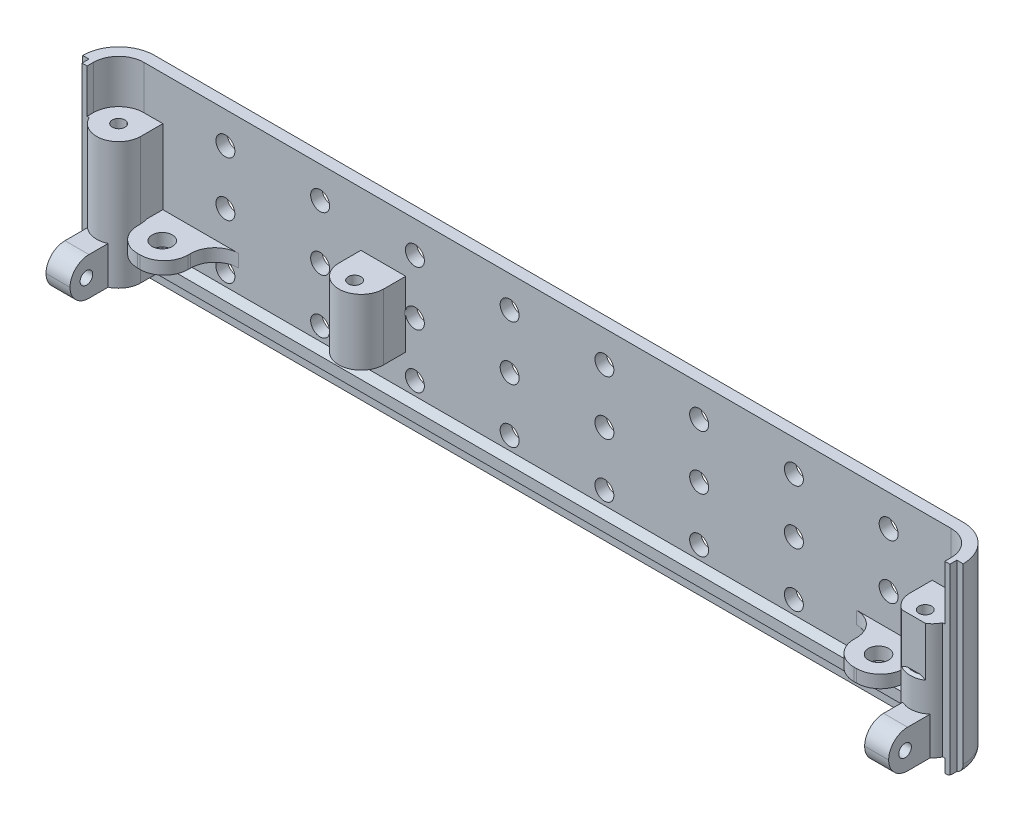
from build123d import *

# Parameters (mm, degrees)
SKETCH_2_W             = 139.4
SKETCH_2_H             = 29.1
EXTRUDE_1_DEPTH        = 1.8
SKETCH_5_W             = 1.8
SKETCH_5_H             = 29.1
SKETCH_5_H_2           = 29.5
EXTRUDE_2_DEPTH        = 5
FILLET_1_R             = 4
FILLET_2_R             = 5.7
SKETCH_12_W            = 5
SKETCH_12_H            = 0.4
CUT_EXTRUDE_6_DEPTH    = 11.4
SKETCH_13_W            = 8
SKETCH_13_H            = 2
EXTRUDE_3_DEPTH        = 8
SKETCH_14_R            = 1.6
CUT_EXTRUDE_7_DEPTH    = 10
FILLET_3_R             = 3.8
EXTRUDE_START          = 1
EXTRUDE_1_2_DEPTH      = 4.8
CUT_EXTRUDE_8_DEPTH    = 3.1
EXTRUDE_START_2        = -1.7
SKETCH_20_R            = 3.5
SKETCH_20_R_2          = 3.55
EXTRUDE_6_DEPTH        = 18.4
SKETCH_23_R            = 1
CUT_EXTRUDE_9_DEPTH    = 20
SKETCH_24_W            = 0.62363952
SKETCH_24_H            = 2.941002946
SKETCH_24_W_2          = 1.700851863
SKETCH_24_H_2          = 2.050645119
SKETCH_24_W_3          = 4.003246464
SKETCH_24_H_3          = 2.24108386
SKETCH_24_W_4          = 1.045953921
SKETCH_24_H_4          = 1.258351935
SKETCH_24_W_5          = 1.430643865
SKETCH_24_H_5          = 1.487953929
EXTRUDE_9_DEPTH        = 18.4
SKETCH_25_R            = 1
EXTRUDE_10_DEPTH       = 1.7
SKETCH_26_W            = 7.1
SKETCH_26_H            = 7.05
CUT_EXTRUDE_10_DEPTH   = 8
SKETCH_27_W            = 1
SKETCH_27_H            = 1.7
EXTRUDE_11_DEPTH       = 8
SKETCH_29_W            = 0.6
SKETCH_29_H            = 6.4
CUT_EXTRUDE_11_DEPTH   = 8
SKETCH_30_W            = 1.1
SKETCH_30_H            = 29.1
CUT_EXTRUDE_12_DEPTH   = 1
FILLET_1_OF_MIRROR_9_R = 4
FILLET_2_OF_MIRROR_9_R = 5.7
FILLET_3_OF_MIRROR_9_R = 3.8
SKETCH_31_W            = 147.148234899
SKETCH_31_H            = 20.734599879
CUT_EXTRUDE_13_DEPTH   = 40
SKETCH_33_W            = 5
SKETCH_33_H            = 0.4
CUT_EXTRUDE_14_DEPTH   = 10
SKETCH_34_W            = 1
SKETCH_34_H            = 1.7
EXTRUDE_12_DEPTH       = 10
SKETCH_35_W            = 1.1
SKETCH_35_H            = 29.1
CUT_EXTRUDE_15_DEPTH   = 1
CUT_EXTRUDE_START      = -1
CUT_EXTRUDE_16_DEPTH   = 1
CHAMFER_1_SIZE         = 0.4
CHAMFER_2_SIZE         = 1
SKETCH_37_W            = 3
SKETCH_37_H            = 27.1
EXTRUDE_13_DEPTH       = 2
SKETCH_38_R            = 1.5
CUT_EXTRUDE_17_DEPTH   = 2
SKETCH_39_R            = 1
EXTRUDE_14_DEPTH       = 10.4
SKETCH_40_R            = 1
CUT_EXTRUDE_18_DEPTH   = 10.4
EXTRUDE_15_DEPTH       = 0.8
SKETCH_42_W            = 7.7
SKETCH_42_H            = 6
EXTRUDE_16_DEPTH       = 5
SKETCH_43_W            = 7.7
SKETCH_43_H            = 6
EXTRUDE_17_DEPTH       = 5
CUT_EXTRUDE_19_DEPTH   = 75.59745304
FILLET_4_R             = 3
SKETCH_45_R            = 1
CUT_EXTRUDE_20_DEPTH   = 139.225440857
CHAMFER_5_SIZE         = 2
FILLET_6_R             = 1.6


# Some blends are built 0.0001 mm under size
with BuildPart() as part:
    # Эскиз2 → Extrude 1 (new body)
    with BuildSketch(Plane.XY):
        with Locations((0, -0.8)):
            Rectangle(SKETCH_2_W, SKETCH_2_H)
    extrude_1 = extrude(amount=EXTRUDE_1_DEPTH)

    # Эскиз5 → Бобышка-Вытянуть2 (add)
    with BuildSketch(Plane(origin=(0, 0, 0), x_dir=(-1, 0, 0), z_dir=(0, 0, -1))):
        with Locations((68.8, -0.8)):
            Rectangle(SKETCH_5_W, SKETCH_5_H)
        with Locations((-68.8, -1)):
            Rectangle(SKETCH_5_W, SKETCH_5_H_2)
    extrude_2 = extrude(amount=EXTRUDE_2_DEPTH)

    # Скругление1
    fillet_1_edges = [part.edges().sort_by_distance(p)[0] for p in [
        (-67.9, -0.8, 0),
        (67.9, -0.8, 0),
    ]]
    fillet(fillet_1_edges, radius=FILLET_1_R)

    # Скругление2
    fillet_2_edges = [part.edges().sort_by_distance(p)[0] for p in [
        (69.7, -0.8, 1.8),
        (-69.7, -0.8, 1.8),
    ]]
    fillet(fillet_2_edges, radius=FILLET_2_R)

    # Эскиз12 → Вырез-Вытянуть6 (cut)
    with BuildSketch(Plane.ZY.offset(-67.9)):
        with Locations((-2.5, -15.55)):
            Rectangle(SKETCH_12_W, SKETCH_12_H)
    extrude(amount=-CUT_EXTRUDE_6_DEPTH, mode=Mode.SUBTRACT)

    # Эскиз13 → Бобышка-Вытянуть3 (add)
    with BuildSketch(Plane(origin=(0, 0, 0), x_dir=(-1, 0, 0), z_dir=(0, 0, -1))):
        with Locations((-56.7, -5.95)):
            Rectangle(SKETCH_13_W, SKETCH_13_H)
        with Locations((56.7, -5.95)):
            Rectangle(SKETCH_13_W, SKETCH_13_H)
    extrude_3 = extrude(amount=EXTRUDE_3_DEPTH)

    # Эскиз14 → Вырез-Вытянуть7 (cut)
    with BuildSketch(Plane(origin=(0, -4.95, 0), x_dir=(1, 0, 0), z_dir=(0, 1, 0))):
        with Locations(Location((-56.7, 4.3, 0), (0, 0, 270))):
            Circle(SKETCH_14_R)
        with Locations(Location((56.7, 4.3, 0), (0, 0, 270))):
            Circle(SKETCH_14_R)
    cut_extrude_7 = extrude(amount=-CUT_EXTRUDE_7_DEPTH, mode=Mode.SUBTRACT)

    # Скругление3
    # the kernel refuses this fillet: 3.8 mm, written as the material it adds along each edge
    with BuildSketch(Plane(origin=(60.7, -6.95, 0), x_dir=(1, 0, 0), z_dir=(0, 1, 0)), Plane(origin=(52.7, -4.95, 0), x_dir=(-1, 0, 0), z_dir=(0, -1, 0)), Plane(origin=(-52.7, -6.95, 0), x_dir=(1, 0, 0), z_dir=(0, 1, 0)), Plane(origin=(-60.7, -4.95, 0), x_dir=(-1, 0, 0), z_dir=(0, -1, 0))) as fillet_3_piece_1:
        with BuildLine():
            CenterArc((FILLET_3_R, FILLET_3_R), FILLET_3_R, 180, 90)
            Line((0, FILLET_3_R), (0, 0))
            Line((0, 0), (FILLET_3_R, 0))
        make_face()
    extrude(amount=2)
    # the kernel refuses this fillet: 3.8 mm, written as the material it takes off along each edge
    with BuildSketch(Plane(origin=(60.7, -16.45, -8), x_dir=(-1, 0, 0), z_dir=(0, 1, 0)), Plane(origin=(-60.7, 4.55, -8), x_dir=(1, 0, 0), z_dir=(0, -1, 0))) as fillet_3_2_piece_1:
        with BuildLine():
            CenterArc((FILLET_3_R, FILLET_3_R), FILLET_3_R, 180, 90)
            Line((0, FILLET_3_R), (0, 0))
            Line((0, 0), (FILLET_3_R, 0))
        make_face()
    extrude(amount=21, mode=Mode.SUBTRACT)
    with BuildSketch(Plane(origin=(52.7, 4.55, -8), x_dir=(0, 0, 1), z_dir=(0, -1, 0)), Plane(origin=(-52.7, -16.45, -8), x_dir=(0, 0, 1), z_dir=(0, 1, 0))) as fillet_3_2_piece_2:
        with BuildLine():
            CenterArc((FILLET_3_R, -FILLET_3_R), FILLET_3_R, 90, 90)
            Line((0, -FILLET_3_R), (0, 0))
            Line((0, 0), (FILLET_3_R, 0))
        make_face()
    extrude(amount=21, mode=Mode.SUBTRACT)

    # Эскиз18 → Extrude 1 2 (add)
    with BuildSketch(Plane.XZ.offset(15.35).offset(EXTRUDE_START)):
        with BuildLine():
            Line((-67.9, -5), (-67.9, -4))
            ThreePointArc((-67.9, -4), (-66.728427125, -1.171572875), (-63.9, 0))
            Line((-63.9, 0), (63.9, 0))
            ThreePointArc((63.9, 0), (66.728427125, -1.171572875), (67.9, -4))
            Line((67.9, -4), (67.9, -5))
            Line((67.9, -5), (66.9, -5))
            Line((66.9, -5), (66.9, -4))
            ThreePointArc((66.9, -4), (66.021320344, -1.878679656), (63.9, -1))
            Line((63.9, -1), (-63.9, -1))
            ThreePointArc((-63.9, -1), (-66.021320344, -1.878679656), (-66.9, -4))
            Line((-66.9, -4), (-66.9, -5))
            Line((-66.9, -5), (-67.9, -5))
        make_face()
    extrude_1_2 = extrude(amount=-EXTRUDE_1_2_DEPTH)

    # Эскиз19 → Вырез-Вытянуть8 (cut)
    with BuildSketch(Plane.XZ.offset(16.35)):
        with BuildLine():
            Line((66.9, -4), (66.9, -5))
            Line((66.9, -5), (67.9, -5))
            Line((67.9, -5), (67.9, -4))
            ThreePointArc((67.9, -4), (66.728427125, -1.171572875), (63.9, 0))
            Line((63.9, 0), (-63.9, 0))
            ThreePointArc((-63.9, 0), (-66.728427125, -1.171572875), (-67.9, -4))
            Line((-67.9, -4), (-67.9, -5))
            Line((-67.9, -5), (-66.9, -5))
            Line((-66.9, -5), (-66.9, -4))
            ThreePointArc((-66.9, -4), (-66.021320344, -1.878679656), (-63.9, -1))
            Line((-63.9, -1), (63.9, -1))
            ThreePointArc((63.9, -1), (66.021320344, -1.878679656), (66.9, -4))
        make_face()
    cut_extrude_8 = extrude(amount=-CUT_EXTRUDE_8_DEPTH, mode=Mode.SUBTRACT)

    # Эскиз20 → Бобышка-Вытянуть6 (add)
    with BuildSketch(Plane(origin=(0, -11.55, 0), x_dir=(1, 0, 0), z_dir=(0, 1, 0)).offset(EXTRUDE_START_2)):
        with Locations((-64.4, 3.5)):
            Circle(SKETCH_20_R)
        with Locations((64.4, 3.5)):
            Circle(SKETCH_20_R)
        with Locations((-26, 3.5)):
            Circle(SKETCH_20_R_2)
    extrude_6 = extrude(amount=EXTRUDE_6_DEPTH)

    # Эскиз23 → Вырез-Вытянуть9 (cut)
    with BuildSketch(Plane(origin=(0, 5.15, 0), x_dir=(1, 0, 0), z_dir=(0, 1, 0))):
        with Locations(Location((-64.4, 3.5, 0), (0, 0, 270))):
            Circle(SKETCH_23_R)
        with Locations(Location((-26, 3.5, 0), (0, 0, 270))):
            Circle(SKETCH_23_R)
        with Locations(Location((64.4, 3.5, 0), (0, 0, 270))):
            Circle(SKETCH_23_R)
    cut_extrude_9 = extrude(amount=-CUT_EXTRUDE_9_DEPTH, mode=Mode.SUBTRACT)

    # Эскиз24 → Бобышка-Вытянуть9 (add)
    with BuildSketch(Plane(origin=(0, 5.15, 0), x_dir=(1, 0, 0), z_dir=(0, 1, 0))):
        with Locations((-67.58818024, 3.529498527)):
            Rectangle(SKETCH_24_W, SKETCH_24_H)
        Polygon((-60.9, -0.98216772), (-60.9, 3.5), (-62.457500072, 3.5), (-62.457500072, 2.058997054), (-62.457500072, 0.008351935), (-62.457500072, -0.98216772), align=None)
        with Locations((-63.307926004, 1.033674495)):
            Rectangle(SKETCH_24_W_2, SKETCH_24_H_2)
        Polygon((-28.283629168, 3.5), (-29.55, 3.5), (-29.55, -0.98216772), (-28.283629168, -0.98216772), (-28.283629168, 1.25891614), align=None)
        with Locations((-26.282005936, 0.13837421)):
            Rectangle(SKETCH_24_W_3, SKETCH_24_H_3)
        Polygon((-24.280382704, 3.5), (-24.280382704, 1.25891614), (-24.280382704, -0.98216772), (-22.45, -0.98216772), (-22.45, 3.5), align=None)
        with Locations((67.368671105, 4.370824032)):
            Rectangle(SKETCH_24_W_4, SKETCH_24_H_4)
        Polygon((62.72770807, 3.5), (60.9, 3.5), (60.9, -0.98216772), (62.72770807, -0.98216772), (62.72770807, 0.008351935), (62.72770807, 1.496305864), align=None)
        with Locations((63.443030003, 0.7523289)):
            Rectangle(SKETCH_24_W_5, SKETCH_24_H_5)
    extrude_9 = extrude(amount=-EXTRUDE_9_DEPTH)

    # Эскиз25 → Бобышка-Вытянуть10 (add)
    with BuildSketch(Plane(origin=(0, 5.15, 0), x_dir=(1, 0, 0), z_dir=(0, 1, 0))):
        with BuildLine():
            Line((-64.158351935, 0.008351935), (-62.457500072, 0.008351935))
            Line((-62.457500072, 0.008351935), (-62.457500072, 0))
            Line((-62.457500072, 0), (-60.9, 0))
            Line((-60.9, 0), (-60.9, 3.5))
            ThreePointArc((-60.9, 3.5), (-63.631225589, 6.914525722), (-67.56227766, 5))
            Line((-67.56227766, 5), (-67.9, 5))
            Line((-67.9, 5), (-67.9, 4))
            ThreePointArc((-67.9, 4), (-66.818339231, 1.264438608), (-64.158351935, 0.008351935))
        make_face()
        with Locations(Location((-64.4, 3.5, 0), (0, 0, 270))):
            Circle(SKETCH_25_R, mode=Mode.SUBTRACT)
    extrude_10 = extrude(amount=EXTRUDE_10_DEPTH)

    # Эскиз26 → Вырез-Вытянуть10 (cut)
    with BuildSketch(Plane.XZ.offset(13.25)):
        with Locations((-26, -3.525)):
            Rectangle(SKETCH_26_W, SKETCH_26_H)
    cut_extrude_10 = extrude(amount=-CUT_EXTRUDE_10_DEPTH, mode=Mode.SUBTRACT)

    # Эскиз27 → Бобышка-Вытянуть11 (add)
    with BuildSketch(Plane(origin=(-29.55, 0, 0), x_dir=(0, 0, -1), z_dir=(1, 0, 0))):
        with Locations((0.5, -12.4)):
            Rectangle(SKETCH_27_W, SKETCH_27_H)
    extrude(amount=EXTRUDE_11_DEPTH)

    # Эскиз29 → Вырез-Вытянуть11 (cut)
    with BuildSketch(Plane(origin=(69.7, 0, 0), x_dir=(0, 0, -1), z_dir=(1, 0, 0))):
        with Locations((6.75, 1.95)):
            Rectangle(SKETCH_29_W, SKETCH_29_H)
    cut_extrude_11 = extrude(amount=-CUT_EXTRUDE_11_DEPTH, mode=Mode.SUBTRACT)

    # Эскиз30 → Вырез-Вытянуть12 (cut)
    with BuildSketch(Plane(origin=(69.7, 0, 0), x_dir=(0, 0, -1), z_dir=(1, 0, 0))):
        with Locations((4.45, -0.8)):
            Rectangle(SKETCH_30_W, SKETCH_30_H)
    cut_extrude_12 = extrude(amount=-CUT_EXTRUDE_12_DEPTH, mode=Mode.SUBTRACT)


with BuildPart() as mirror_9_1:
    # Зеркальное отражение9: Extrude 1, Бобышка-Вытянуть2, Бобышка-Вытянуть3 across plane
    add(extrude_1.mirror(Plane.XY.offset(1.8)))
    add(extrude_2.mirror(Plane.XY.offset(1.8)))
    add(extrude_3.mirror(Plane.XY.offset(1.8)))

    # Mirror 9 2: Вырез-Вытянуть7 across plane
    add(cut_extrude_7.mirror(Plane.XY.offset(1.8)), mode=Mode.SUBTRACT)


with BuildPart() as mirror_9_3_1:
    # Mirror 9 3: Extrude 1 2 across plane
    add(extrude_1_2.mirror(Plane.XY.offset(1.8)))

    # Mirror 9 4: Вырез-Вытянуть8 across plane
    add(cut_extrude_8.mirror(Plane.XY.offset(1.8)), mode=Mode.SUBTRACT)


with BuildPart() as mirror_9_5_1:
    # Mirror 9 5: Бобышка-Вытянуть6 across plane
    add(extrude_6.mirror(Plane.XY.offset(1.8)))

    # Mirror 9 6: Вырез-Вытянуть9 across plane
    add(cut_extrude_9.mirror(Plane.XY.offset(1.8)), mode=Mode.SUBTRACT)


with BuildPart() as mirror_9_7_1:
    # Mirror 9 7: Бобышка-Вытянуть9, Бобышка-Вытянуть10 across plane
    add(extrude_9.mirror(Plane.XY.offset(1.8)))
    add(extrude_10.mirror(Plane.XY.offset(1.8)))


with BuildPart() as mirror_9_8_tool:
    # Mirror 9 8: Вырез-Вытянуть10, Вырез-Вытянуть11, Вырез-Вытянуть12 across plane
    add(cut_extrude_10.mirror(Plane.XY.offset(1.8)))
    add(cut_extrude_11.mirror(Plane.XY.offset(1.8)))
    add(cut_extrude_12.mirror(Plane.XY.offset(1.8)))


with BuildPart() as mirror_9_1_1:
    add(mirror_9_1.part)

    # Mirror 9 8: cut by mirror_9_8_tool
    add(mirror_9_8_tool.part, mode=Mode.SUBTRACT)

    # Скругление1 of Зеркальное отражение9
    fillet_1_of_mirror_9_edges = [mirror_9_1_1.edges().sort_by_distance(p)[0] for p in [
        (-67.9, -0.8, 3.6),
        (67.9, -0.8, 3.6),
    ]]
    fillet(fillet_1_of_mirror_9_edges, radius=FILLET_1_OF_MIRROR_9_R)

    # Скругление2 of Зеркальное отражение9
    fillet_2_of_mirror_9_edges = [mirror_9_1_1.edges().sort_by_distance(p)[0] for p in [
        (69.7, -0.8, 1.8),
        (-69.7, -0.8, 1.8),
    ]]
    fillet(fillet_2_of_mirror_9_edges, radius=FILLET_2_OF_MIRROR_9_R)

    # Скругление3 of Зеркальное отражение9
    # the kernel refuses this fillet: 3.8 mm, written as the material it adds along each edge
    with BuildSketch(Plane(origin=(60.7, -6.95, 3.6), x_dir=(1, 0, 0), z_dir=(0, 1, 0)), Plane(origin=(52.7, -4.95, 3.6), x_dir=(-1, 0, 0), z_dir=(0, -1, 0)), Plane(origin=(-52.7, -6.95, 3.6), x_dir=(1, 0, 0), z_dir=(0, 1, 0)), Plane(origin=(-60.7, -4.95, 3.6), x_dir=(-1, 0, 0), z_dir=(0, -1, 0))) as fillet_3_of_mirror_9_piece_1:
        with BuildLine():
            CenterArc((FILLET_3_OF_MIRROR_9_R, -FILLET_3_OF_MIRROR_9_R), FILLET_3_OF_MIRROR_9_R, 90, 90)
            Line((0, -FILLET_3_OF_MIRROR_9_R), (0, 0))
            Line((0, 0), (FILLET_3_OF_MIRROR_9_R, 0))
        make_face()
    extrude(amount=2)
    # the kernel refuses this fillet: 3.8 mm, written as the material it takes off along each edge
    with BuildSketch(Plane(origin=(60.7, -16.45, 11.6), x_dir=(0, 0, -1), z_dir=(0, 1, 0)), Plane(origin=(-60.7, 4.55, 11.6), x_dir=(0, 0, -1), z_dir=(0, -1, 0))) as fillet_3_of_mirror_9_2_piece_1:
        with BuildLine():
            CenterArc((FILLET_3_OF_MIRROR_9_R, FILLET_3_OF_MIRROR_9_R), FILLET_3_OF_MIRROR_9_R, 180, 90)
            Line((0, FILLET_3_OF_MIRROR_9_R), (0, 0))
            Line((0, 0), (FILLET_3_OF_MIRROR_9_R, 0))
        make_face()
    extrude(amount=21, mode=Mode.SUBTRACT)
    with BuildSketch(Plane(origin=(52.7, 4.55, 11.6), x_dir=(1, 0, 0), z_dir=(0, -1, 0)), Plane(origin=(-52.7, -16.45, 11.6), x_dir=(-1, 0, 0), z_dir=(0, 1, 0))) as fillet_3_of_mirror_9_2_piece_2:
        with BuildLine():
            CenterArc((FILLET_3_OF_MIRROR_9_R, -FILLET_3_OF_MIRROR_9_R), FILLET_3_OF_MIRROR_9_R, 90, 90)
            Line((0, -FILLET_3_OF_MIRROR_9_R), (0, 0))
            Line((0, 0), (FILLET_3_OF_MIRROR_9_R, 0))
        make_face()
    extrude(amount=21, mode=Mode.SUBTRACT)


with BuildPart() as mirror_9_3_1_1:
    add(mirror_9_3_1.part)

    # Mirror 9 8: cut by mirror_9_8_tool
    add(mirror_9_8_tool.part, mode=Mode.SUBTRACT)


with BuildPart() as mirror_9_5_1_1:
    add(mirror_9_5_1.part)

    # Mirror 9 8: cut by mirror_9_8_tool
    add(mirror_9_8_tool.part, mode=Mode.SUBTRACT)


with BuildPart() as mirror_9_7_1_1:
    add(mirror_9_7_1.part)

    # Mirror 9 8: cut by mirror_9_8_tool
    add(mirror_9_8_tool.part, mode=Mode.SUBTRACT)


with BuildPart() as part_1:
    add(part.part)

    # Зеркальное отражение9 united with what the copies tou: union Зеркальное отражение9_1, Зеркальное отражение9 3_1, Зеркальное отражение9 5_1, Зеркальное отражение9 7_1
    add(mirror_9_1_1.part)
    add(mirror_9_3_1_1.part)
    add(mirror_9_5_1_1.part)
    add(mirror_9_7_1_1.part)

    # Эскиз31 → Вырез-Вытянуть13 (cut)
    with BuildSketch(Plane(origin=(0, 13.75, 0), x_dir=(1, 0, 0), z_dir=(0, 1, 0))):
        with Locations((2.208812356, 8.567299939)):
            Rectangle(SKETCH_31_W, SKETCH_31_H)
    extrude(amount=-CUT_EXTRUDE_13_DEPTH, mode=Mode.SUBTRACT)

    # Эскиз33 → Вырез-Вытянуть14 (cut)
    with BuildSketch(Plane.ZY.offset(-67.9)):
        with Locations((6.1, -15.55)):
            Rectangle(SKETCH_33_W, SKETCH_33_H)
    extrude(amount=-CUT_EXTRUDE_14_DEPTH, mode=Mode.SUBTRACT)

    # Эскиз34 → Бобышка-Вытянуть12 (add)
    with BuildSketch(Plane.ZY.offset(22.45)):
        with Locations((4.1, -12.4)):
            Rectangle(SKETCH_34_W, SKETCH_34_H)
    extrude(amount=EXTRUDE_12_DEPTH)

    # Эскиз35 → Вырез-Вытянуть15 (cut)
    with BuildSketch(Plane.ZY.offset(69.7)):
        with Locations((8.05, -0.8)):
            Rectangle(SKETCH_35_W, SKETCH_35_H)
    extrude(amount=-CUT_EXTRUDE_15_DEPTH, mode=Mode.SUBTRACT)

    # Эскиз36 → Вырез-Вытянуть16 (cut)
    with BuildSketch(Plane(origin=(0, -1.25, 0), x_dir=(1, 0, 0), z_dir=(0, 1, 0)).offset(CUT_EXTRUDE_START)):
        with BuildLine():
            Line((66.28348082, -10.05), (62.51651918, -10.05))
            ThreePointArc((62.51651918, -10.05), (64.4, -10.6), (66.28348082, -10.05))
        make_face()
    extrude(amount=CUT_EXTRUDE_16_DEPTH, mode=Mode.SUBTRACT)

    # Фаска1
    chamfer_1_edges = [part_1.edges().sort_by_distance(p)[0] for p in [
        (64.4, -2.25, 10.6),
    ]]
    chamfer(chamfer_1_edges, length=CHAMFER_1_SIZE)

    # Фаска2
    chamfer_2_edges = [part_1.edges().sort_by_distance(p)[0] for p in [
        (0, -11.55, 3.6),
    ]]
    chamfer(chamfer_2_edges, length=CHAMFER_2_SIZE - 0.0001)  # a hair under: the kernel refuses the full size

    # Эскиз37 → Бобышка-Вытянуть13 (add)
    with BuildSketch(Plane(origin=(0, 0, 1.8), x_dir=(-1, 0, 0), z_dir=(0, 0, -1))):
        with Locations((-60.5, 0.2)):
            Rectangle(SKETCH_37_W, SKETCH_37_H)
        with Locations((60.5, 0.2)):
            Rectangle(SKETCH_37_W, SKETCH_37_H)
    extrude(amount=EXTRUDE_13_DEPTH)

    # Эскиз38 → Вырез-Вытянуть17 (cut)
    with BuildSketch(Plane(origin=(0, 0, 1.8), x_dir=(-1, 0, 0), z_dir=(0, 0, -1))):
        with Locations((-54, 8.75)):
            Circle(SKETCH_38_R)
        with Locations((-39, 8.75)):
            Circle(SKETCH_38_R)
        with Locations((-24, 8.75)):
            Circle(SKETCH_38_R)
        with Locations((-9, 8.75)):
            Circle(SKETCH_38_R)
        with Locations((6, 8.75)):
            Circle(SKETCH_38_R)
        with Locations((21, 8.75)):
            Circle(SKETCH_38_R)
        with Locations((36, 8.75)):
            Circle(SKETCH_38_R)
        with Locations((51, 8.75)):
            Circle(SKETCH_38_R)
        with Locations((-39, 0.15)):
            Circle(SKETCH_38_R)
        with Locations((-24, 0.15)):
            Circle(SKETCH_38_R)
        with Locations((-9, 0.15)):
            Circle(SKETCH_38_R)
        with Locations((6, 0.15)):
            Circle(SKETCH_38_R)
        with Locations((21, 0.15)):
            Circle(SKETCH_38_R)
        with Locations((36, 0.15)):
            Circle(SKETCH_38_R)
        with Locations((51, 0.15)):
            Circle(SKETCH_38_R)
        with Locations((-39, -8.45)):
            Circle(SKETCH_38_R)
        with Locations((-24, -8.45)):
            Circle(SKETCH_38_R)
        with Locations((-9, -8.45)):
            Circle(SKETCH_38_R)
        with Locations((6, -8.45)):
            Circle(SKETCH_38_R)
        with Locations((21, -8.45)):
            Circle(SKETCH_38_R)
        with Locations((36, -8.45)):
            Circle(SKETCH_38_R)
        with Locations((51, -8.45)):
            Circle(SKETCH_38_R)
        with Locations((-54, 0.15)):
            Circle(SKETCH_38_R)
        with Locations((-54, -8.45)):
            Circle(SKETCH_38_R)
    extrude(amount=-CUT_EXTRUDE_17_DEPTH, mode=Mode.SUBTRACT)

    # Эскиз39 → Бобышка-Вытянуть14 (add)
    with BuildSketch(Plane(origin=(0, 5.15, 0), x_dir=(1, 0, 0), z_dir=(0, 1, 0))):
        with Locations((-26, -7.1)):
            Circle(SKETCH_39_R)
        with Locations(Location((64.4, -7.1, 0), (0, 0, 270))):
            Circle(SKETCH_39_R)
    extrude(amount=-EXTRUDE_14_DEPTH)

    # Эскиз40 → Вырез-Вытянуть18 (cut)
    with BuildSketch(Plane(origin=(0, 5.15, 0), x_dir=(1, 0, 0), z_dir=(0, 1, 0))):
        with Locations(Location((-25.95, -8.2, 0), (0, 0, 270))):
            Circle(SKETCH_40_R)
        with Locations(Location((64.4, -8.2, 0), (0, 0, 270))):
            Circle(SKETCH_40_R)
    extrude(amount=-CUT_EXTRUDE_18_DEPTH, mode=Mode.SUBTRACT)

    # Эскиз41 → Бобышка-Вытянуть15 (add)
    with BuildSketch(Plane.XY.offset(8.6)):
        Polygon((68.7, 13.75), (68.7, -15.35), (67.9, -15.35), (67.9, -13.25), (67.56227766, -13.25), (67.56227766, 5.15), (67.891648065, 5.15), (67.9, 5.15), (67.9, 13.75), align=None)
    extrude(amount=-EXTRUDE_15_DEPTH)

    # Эскиз42 → Бобышка-Вытянуть16 (add)
    with BuildSketch(Plane(origin=(-67.9, 0, 0), x_dir=(0, 0, -1), z_dir=(1, 0, 0))):
        with Locations((-12.45, -10.25)):
            Rectangle(SKETCH_42_W, SKETCH_42_H)
    extrude(amount=EXTRUDE_16_DEPTH)

    # Эскиз43 → Бобышка-Вытянуть17 (add)
    with BuildSketch(Plane.ZY.offset(-67.9)):
        with Locations((12.45, -10.25)):
            Rectangle(SKETCH_43_W, SKETCH_43_H)
    extrude(amount=EXTRUDE_17_DEPTH)

    # Эскиз44 → Вырез-Вытянуть19 (cut, through all)
    with BuildSketch(Plane(origin=(0, -7.25, 0), x_dir=(1, 0, 0), z_dir=(0, 1, 0))):
        with BuildLine():
            ThreePointArc((-66.7, -9.738181192), (-67.189799888, -9.21353178), (-67.56227766, -8.6))
            Line((-67.56227766, -8.6), (-67.9, -8.6))
            Line((-67.9, -8.6), (-67.9, -16.3))
            Line((-67.9, -16.3), (-66.7, -16.3))
            Line((-66.7, -16.3), (-66.7, -9.738181192))
        make_face()
        with BuildLine():
            Line((66.7, -16.3), (67.9, -16.3))
            Line((67.9, -16.3), (67.9, -8.6))
            Line((67.9, -8.6), (67.56227766, -8.6))
            ThreePointArc((67.56227766, -8.6), (67.189799888, -9.21353178), (66.7, -9.738181192))
            Line((66.7, -9.738181192), (66.7, -16.3))
        make_face()
    extrude(amount=-CUT_EXTRUDE_19_DEPTH, mode=Mode.SUBTRACT)

    # Скругление4
    fillet_4_edges = [part_1.edges().sort_by_distance(p)[0] for p in [
        (-64.8, -13.25, 16.3),
        (-64.8, -7.25, 16.3),
        (64.8, -13.25, 16.3),
        (64.8, -7.25, 16.3),
    ]]
    fillet(fillet_4_edges, radius=FILLET_4_R - 0.0001)  # a hair under: the kernel refuses the full size

    # Эскиз45 → Вырез-Вытянуть20 (cut, through all)
    with BuildSketch(Plane(origin=(66.7, 0, 0), x_dir=(0, 0, -1), z_dir=(1, 0, 0))):
        with Locations((-13.7, -10.25)):
            Circle(SKETCH_45_R)
    extrude(amount=-CUT_EXTRUDE_20_DEPTH, mode=Mode.SUBTRACT)

    # Фаска5
    chamfer_5_edges = [part_1.edges().sort_by_distance(p)[0] for p in [
        (-60.5, -13.35, -0.2),
        (-60.5, 13.75, -0.2),
        (60.5, 13.75, -0.2),
        (60.5, -13.35, -0.2),
    ]]
    chamfer(chamfer_5_edges, length=CHAMFER_5_SIZE - 0.0001)  # a hair under: the kernel refuses the full size

    # Скругление6
    # the kernel refuses this fillet: 1.6 mm, written as the material it takes off along each edge
    with BuildSketch(Plane(origin=(64, -15.35, 7.5), x_dir=(0.7635287907659433, 0, 0.6457737883125148), z_dir=(-0.6457737883125148, 0, 0.7635287907659433))) as fillet_6_piece_1:
        with BuildLine():
            CenterArc((5.7 - FILLET_6_R, FILLET_6_R), FILLET_6_R, 270, 90)
            Line((5.7 - FILLET_6_R, 0), (5.7, 0))
            Line((5.7, 0), (5.7, FILLET_6_R))
        make_face()
    revolve(axis=Axis((64, -15.35, 7.5), (0, 1, 0)), revolution_arc=130.223716277, mode=Mode.SUBTRACT)
    with BuildSketch(Plane(origin=(-64, -15.35, 7.5), x_dir=(-0.7635287907659435, 0, 0.6457737883125143), z_dir=(0.6457737883125143, 0, 0.7635287907659435))) as fillet_6_piece_2:
        with BuildLine():
            CenterArc((5.7 - FILLET_6_R, -FILLET_6_R), FILLET_6_R, 0, 90)
            Line((5.7 - FILLET_6_R, 0), (5.7, 0))
            Line((5.7, 0), (5.7, -FILLET_6_R))
        make_face()
    revolve(axis=Axis((-64, -15.35, 7.5), (0, -1, 0)), revolution_arc=130.223716277, mode=Mode.SUBTRACT)
    with BuildSketch(Plane(origin=(64, -15.35, 1.8), x_dir=(0, 1, 0), z_dir=(-1, 0, 0))) as fillet_6_piece_3:
        with BuildLine():
            CenterArc((FILLET_6_R, -FILLET_6_R), FILLET_6_R, 90, 90)
            Line((0, -FILLET_6_R), (0, 0))
            Line((0, 0), (FILLET_6_R, 0))
        make_face()
    extrude(amount=128, mode=Mode.SUBTRACT)


solid = part_1.part
